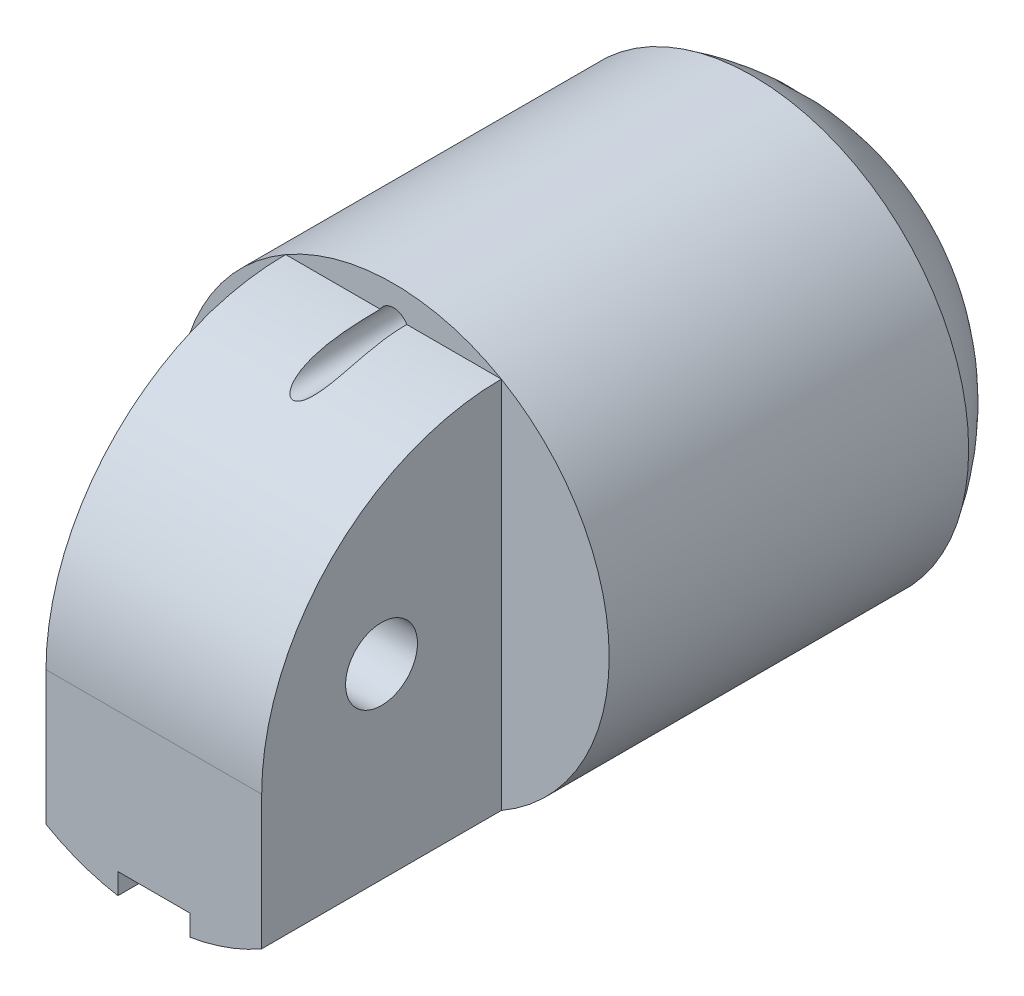
from build123d import *

# Parameters (mm, degrees)
SKETCH1_R               = 9
BOSS_EXTRUDE1_DEPTH     = 15
BOSS_EXTRUDE2_START     = 10
BOSS_EXTRUDE2_DEPTH     = 10
DOME2_FACE_RADIUS       = 9
DOME2_HEIGHT            = 5
CUT_EXTRUDE1_DEPTH      = 24.706539182
CUT_EXTRUDE1_DEPTH_BACK = 24.706539182
SKETCH3_R               = 1.5
FILLET4_R               = 10
CUT_EXTRUDE2_DEPTH      = 24.706539182
CUT_EXTRUDE2_DEPTH_BACK = 24.706539182
SKETCH4_R               = 0.625
SKETCH5_W               = 3
SKETCH5_H               = 2
CUT_EXTRUDE3_DEPTH      = 20
SKETCH6_R               = 0.9
CUT_EXTRUDE4_DEPTH      = 5


with BuildPart() as part:
    # Sketch1 → Boss-Extrude1 (new body)
    with BuildSketch(Plane.XY):
        Circle(SKETCH1_R)
    extrude(amount=-BOSS_EXTRUDE1_DEPTH)

    # Sketch2 → Boss-Extrude2 (add)
    with BuildSketch(Plane.XY.offset(BOSS_EXTRUDE2_START)):
        with BuildLine():
            Line((-4.5, 7.794228634), (-4.5, -7.794228634))
            ThreePointArc((-4.5, -7.794228634), (0, -9), (4.5, -7.794228634))
            Line((4.5, -7.794228634), (4.5, 7.794228634))
            Line((4.5, 7.794228634), (-4.5, 7.794228634))
        make_face()
    extrude(amount=-BOSS_EXTRUDE2_DEPTH)

    # Dome2: a dome of height H over a round flat face of radius A is a cap of a sphere of radius (A * A + H * H) / (2 * H)
    dome2_r = (DOME2_FACE_RADIUS * DOME2_FACE_RADIUS + DOME2_HEIGHT * DOME2_HEIGHT) / (2 * DOME2_HEIGHT)
    dome2_base = Plane((0, 0, -15), z_dir=(0, 0, -1))
    with Locations(dome2_base.offset(DOME2_HEIGHT - dome2_r)):
        dome2_ball = Sphere(dome2_r, mode=Mode.PRIVATE)
    add(split(dome2_ball, bisect_by=dome2_base, keep=Keep.TOP, mode=Mode.PRIVATE))

    # Sketch3 → Cut-Extrude1 (cut, two sides: drawn at the far end of the back side and taken through both)
    with BuildSketch(Plane(origin=(0, 0, 0), x_dir=(0, 0, -1), z_dir=(1, 0, 0)).offset(-CUT_EXTRUDE1_DEPTH_BACK)):
        with Locations((-5, 0)):
            Circle(SKETCH3_R)
    extrude(amount=CUT_EXTRUDE1_DEPTH + CUT_EXTRUDE1_DEPTH_BACK, mode=Mode.SUBTRACT)

    # Fillet4
    fillet4_edges = [part.edges().sort_by_distance(p)[0] for p in [
        (0, 7.794228634, 10),
    ]]
    fillet(fillet4_edges, radius=FILLET4_R - 0.0001)  # a hair under: the kernel refuses the full size

    # Sketch4 → Cut-Extrude2 (cut, two sides: drawn at the far end of the back side and taken through both)
    with BuildSketch(Plane.XY.offset(-CUT_EXTRUDE2_DEPTH_BACK)):
        with Locations(Location((0, 7.5, 0), (0, 0, 28.084018699))):
            Circle(SKETCH4_R)
    extrude(amount=CUT_EXTRUDE2_DEPTH + CUT_EXTRUDE2_DEPTH_BACK, mode=Mode.SUBTRACT)

    # Sketch5 → Cut-Extrude3 (cut)
    with BuildSketch(Plane.XY.offset(10)):
        with Locations((0, -9)):
            Rectangle(SKETCH5_W, SKETCH5_H)
    extrude(amount=-CUT_EXTRUDE3_DEPTH, mode=Mode.SUBTRACT)

    # Sketch6 → Cut-Extrude4 (cut)
    with BuildSketch(Plane(origin=(0, -8, 0), x_dir=(-1, 0, 0), z_dir=(0, -1, 0))):
        with Locations(Location((0, 7, 0), (0, 0, 90))):
            Circle(SKETCH6_R)
    extrude(amount=-CUT_EXTRUDE4_DEPTH, mode=Mode.SUBTRACT)


solid = part.part
